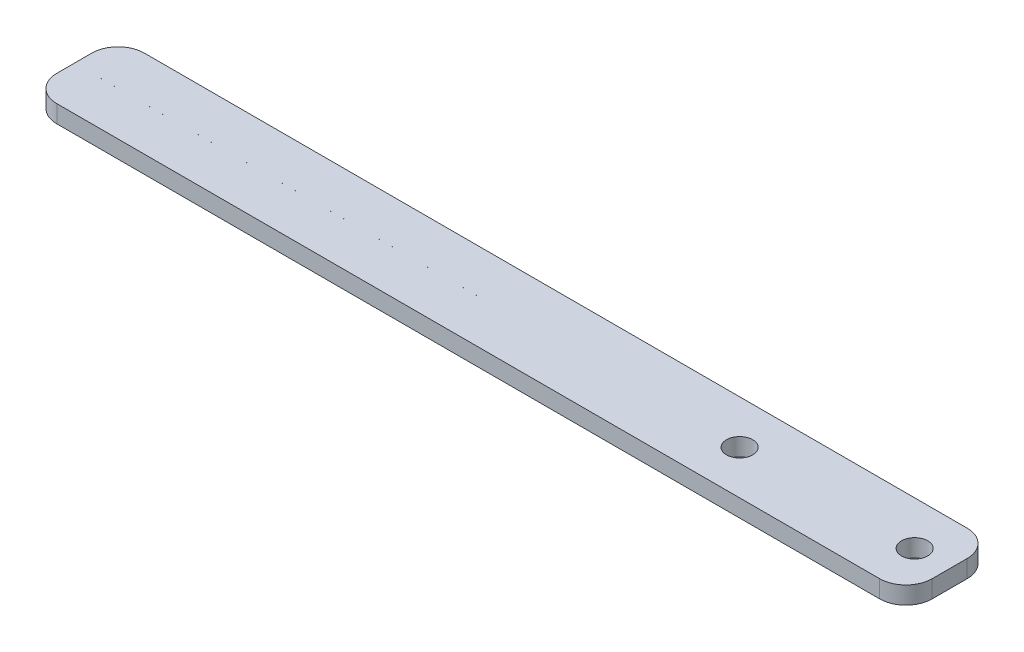
from build123d import *

# Parameters (mm, degrees)
SKETCH1_W             = 100
SKETCH1_H             = 10
BOSS_EXTRUDE1_DEPTH   = 2
FILLET1_R             = 3
F_3_0MM_DOWEL_HOLE1_D = 3
SKETCH2_W             = 47
SKETCH2_H             = 0.001
CUT_EXTRUDE1_DEPTH    = 10


with BuildPart() as part:
    # Sketch1 → Boss-Extrude1 (new body)
    with BuildSketch(Plane(origin=(0, 0, 0), x_dir=(1, 0, 0), z_dir=(0, 1, 0))):
        Rectangle(SKETCH1_W, SKETCH1_H)
    extrude(amount=BOSS_EXTRUDE1_DEPTH)

    # Fillet1
    fillet1_edges = [part.edges().sort_by_distance(p)[0] for p in [
        (50, 1, 5),
        (50, 1, -5),
        (-50, 1, -5),
        (-50, 1, 5),
    ]]
    fillet(fillet1_edges, radius=FILLET1_R)

    # Ø3.0mm Dowel Hole1 (through all)
    with Locations(Plane(origin=(0, 2, 0), x_dir=(1, 0, 0), z_dir=(0, 1, 0))):
        with Locations((46, 0), (26, 0)):
            Hole(F_3_0MM_DOWEL_HOLE1_D / 2)

    # Sketch2 → Cut-Extrude1 (cut)
    with BuildSketch(Plane(origin=(0, 2, 0), x_dir=(1, 0, 0), z_dir=(0, 1, 0))):
        with Locations((-26.5, 0)):
            Rectangle(SKETCH2_W, SKETCH2_H)
    extrude(amount=-CUT_EXTRUDE1_DEPTH, mode=Mode.SUBTRACT)


solid = part.part
